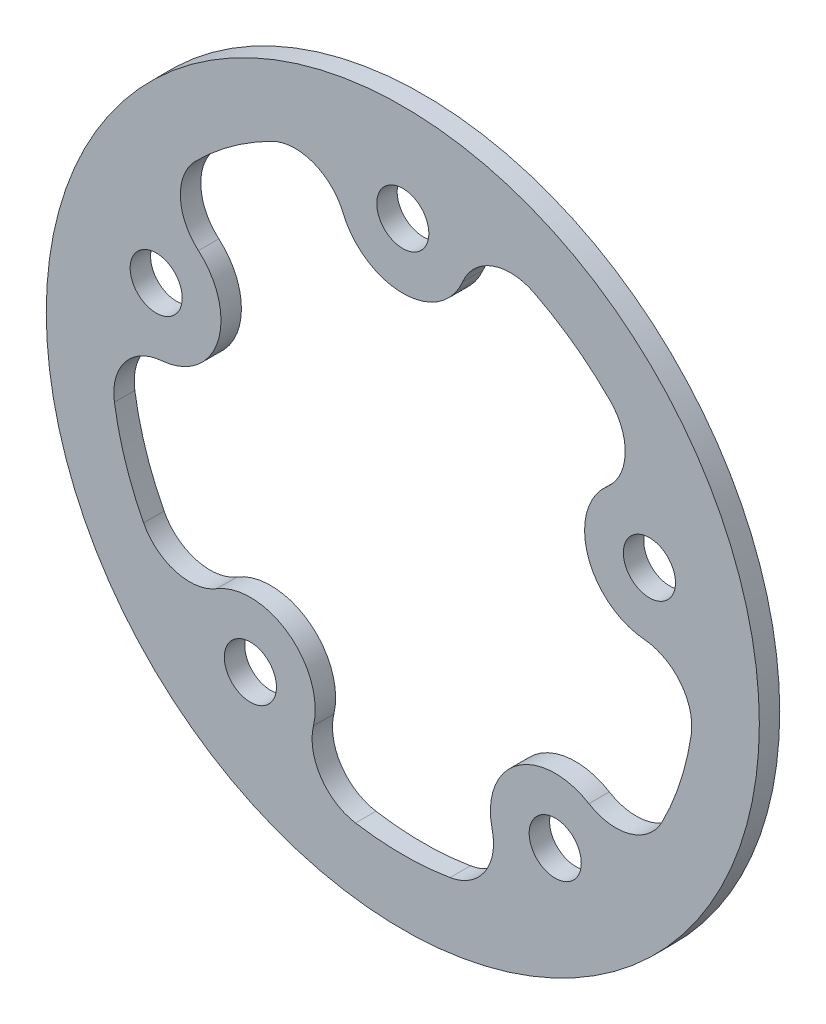
from build123d import *

# Parameters (mm, degrees)
SKETCH1_R           = 34.925
SKETCH1_R_2         = 2.5527
BOSS_EXTRUDE1_DEPTH = 2


with BuildPart() as part:
    # Sketch1 → Boss-Extrude1 (new body)
    with BuildSketch(Plane.XY):
        Circle(SKETCH1_R)
        with Locations((0, 25.4)):
            Circle(SKETCH1_R_2, mode=Mode.SUBTRACT)
        with Locations((24.156835514, 7.849031657)):
            Circle(SKETCH1_R_2, mode=Mode.SUBTRACT)
        with Locations((14.929745408, -20.549031657)):
            Circle(SKETCH1_R_2, mode=Mode.SUBTRACT)
        with Locations((-14.929745408, -20.549031657)):
            Circle(SKETCH1_R_2, mode=Mode.SUBTRACT)
        with Locations((-24.156835514, 7.849031657)):
            Circle(SKETCH1_R_2, mode=Mode.SUBTRACT)
        with BuildLine():
            ThreePointArc((5.85941581, 22.952604167), (0, 19.05), (-5.85941581, 22.952604167))
            ThreePointArc((-5.85941581, 22.952604167), (-8.782139726, 25.758283845), (-12.827369746, 25.534079392))
            ThreePointArc((-12.827369746, 25.534079392), (-16.795963584, 23.117660614), (-20.320477349, 20.090018052))
            ThreePointArc((-20.320477349, 20.090018052), (-21.783753277, 16.312058668), (-20.018564696, 12.66538034))
            ThreePointArc((-20.018564696, 12.66538034), (-18.117626635, 5.886773743), (-23.639882821, 1.520109165))
            ThreePointArc((-23.639882821, 1.520109165), (-27.211414122, -0.39256376), (-28.248227838, -4.309089116))
            ThreePointArc((-28.248227838, -4.309089116), (-27.176439953, -8.830160614), (-25.386115415, -13.117765401))
            ThreePointArc((-25.386115415, -13.117765401), (-22.245239654, -15.676877162), (-18.231569198, -15.124968636))
            ThreePointArc((-18.231569198, -15.124968636), (-11.197309056, -15.411773743), (-8.750835263, -22.013125036))
            ThreePointArc((-8.750835263, -22.013125036), (-8.035439083, -26.000901592), (-4.63099518, -28.197242926))
            ThreePointArc((-4.63099518, -28.197242926), (0, -28.575), (4.63099518, -28.197242926))
            ThreePointArc((4.63099518, -28.197242926), (8.035439083, -26.000901592), (8.750835263, -22.013125036))
            ThreePointArc((8.750835263, -22.013125036), (11.197309056, -15.411773743), (18.231569198, -15.124968636))
            ThreePointArc((18.231569198, -15.124968636), (22.245239654, -15.676877162), (25.386115415, -13.117765401))
            ThreePointArc((25.386115415, -13.117765401), (27.176439953, -8.830160614), (28.248227838, -4.309089116))
            ThreePointArc((28.248227838, -4.309089116), (27.211414122, -0.39256376), (23.639882821, 1.520109165))
            ThreePointArc((23.639882821, 1.520109165), (18.117626635, 5.886773743), (20.018564696, 12.66538034))
            ThreePointArc((20.018564696, 12.66538034), (21.783753277, 16.312058668), (20.320477349, 20.090018052))
            ThreePointArc((20.320477349, 20.090018052), (16.795963584, 23.117660614), (12.827369746, 25.534079392))
            ThreePointArc((12.827369746, 25.534079392), (8.782139726, 25.758283845), (5.85941581, 22.952604167))
        make_face(mode=Mode.SUBTRACT)
    extrude(amount=BOSS_EXTRUDE1_DEPTH)


solid = part.part
